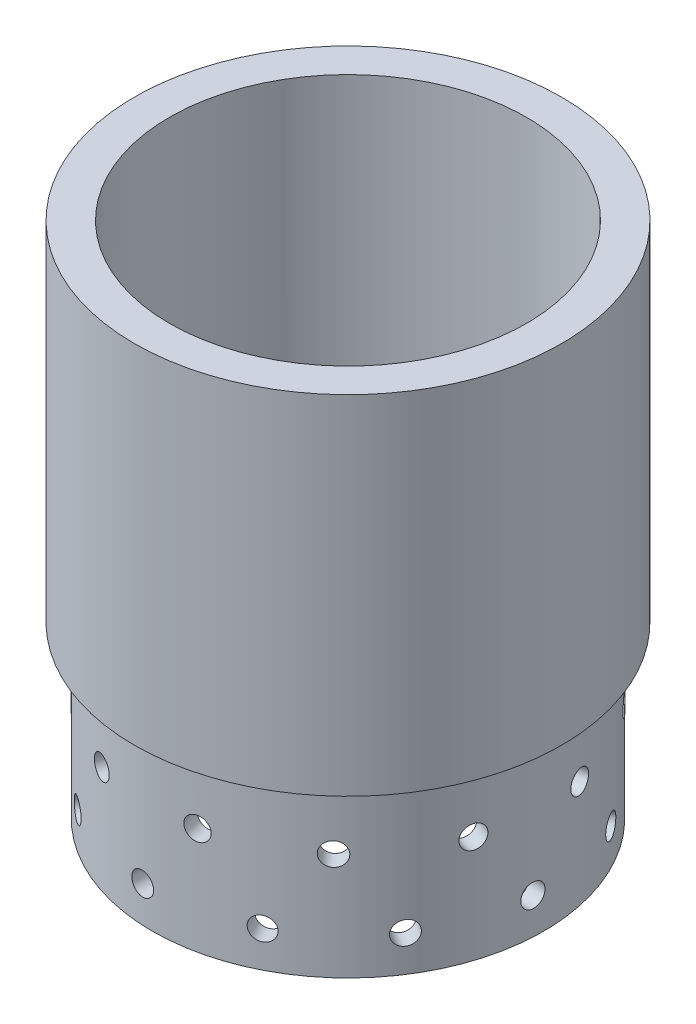
from build123d import *

# Parameters (mm, degrees)
SKETCH1_R           = 69.596
SKETCH1_R_2         = 63.5
BOSS_EXTRUDE1_DEPTH = 57.15
CUT_EXTRUDE2_REACH  = 175.215
SKETCH3_R           = 4.1021
CIRPATTERN2_COUNT   = 12
SKETCH5_R           = 75.946
SKETCH5_R_2         = 63.5
BOSS_EXTRUDE3_DEPTH = 127
MOVE_FACE1_BY       = 3.302
CUT_EXTRUDE3_REACH  = 256.781
SKETCH7_R           = 4.1021
CIRPATTERN3_COUNT   = 12


with BuildPart() as part:
    # Sketch1 → Boss-Extrude1 (new body)
    with BuildSketch(Plane(origin=(0, 0, 0), x_dir=(1, 0, 0), z_dir=(0, 1, 0))):
        Circle(SKETCH1_R)
        Circle(SKETCH1_R_2, mode=Mode.SUBTRACT)
    extrude(amount=BOSS_EXTRUDE1_DEPTH)

    # Sketch3 → Cut-Extrude2 (cut, up to next)
    with BuildSketch(Plane(origin=(-21.506346741, 0, 66.189729308), x_dir=(0, -1, 0), z_dir=(-0.3090169943749482, 0, 0.9510565162951534)), mode=Mode.PRIVATE) as cut_extrude2_sk1:
        with Locations((-38.1, 0)):
            Circle(SKETCH3_R)
    cut_extrude2_tool1 = extrude(cut_extrude2_sk1.sketch, amount=-CUT_EXTRUDE2_REACH, mode=Mode.PRIVATE) & part.part
    cut_extrude2 = cut_extrude2_tool1.solids().sort_by_distance((-21.506347, 38.1, 66.189729))[0]
    add(cut_extrude2, mode=Mode.SUBTRACT)

    # CirPattern2: Cut-Extrude2 ×12 about axis
    cirpattern2_axis = Axis((0, 57.15, 0), (0, -1, 0))
    for i in range(1, CIRPATTERN2_COUNT):
        add(cut_extrude2.rotate(cirpattern2_axis, i * 360 / CIRPATTERN2_COUNT), mode=Mode.SUBTRACT)

    # Sketch5 → Boss-Extrude3 (add)
    with BuildSketch(Plane(origin=(0, 57.15, 0), x_dir=(1, 0, 0), z_dir=(0, 1, 0))):
        Circle(SKETCH5_R)
        Circle(SKETCH5_R_2, mode=Mode.SUBTRACT)
    extrude(amount=BOSS_EXTRUDE3_DEPTH)

    # Move Face1: a face moved inward by 3.302
    extrude(part.faces().sort_by_distance((-37.973, 57.15, 60.7568))[0], amount=MOVE_FACE1_BY, dir=(0, 1, 0), mode=Mode.SUBTRACT)

    # Sketch7 → Cut-Extrude3 (cut, up to next)
    with BuildSketch(Plane(origin=(37.904698281, 0, -58.368116847), x_dir=(0, -1, 0), z_dir=(0.5446390350150282, 0, -0.8386705679454233)), mode=Mode.PRIVATE) as cut_extrude3_sk1:
        with Locations((-12.827, 0)):
            Circle(SKETCH7_R)
    cut_extrude3_tool1 = extrude(cut_extrude3_sk1.sketch, amount=-CUT_EXTRUDE3_REACH, mode=Mode.PRIVATE) & part.part
    cut_extrude3 = cut_extrude3_tool1.solids().sort_by_distance((37.904698, 12.827, -58.368117))[0]
    add(cut_extrude3, mode=Mode.SUBTRACT)

    # CirPattern3: Cut-Extrude3 ×12 about axis
    cirpattern3_axis = Axis((0, 57.15, 0), (0, -1, 0))
    for i in range(1, CIRPATTERN3_COUNT):
        add(cut_extrude3.rotate(cirpattern3_axis, i * 360 / CIRPATTERN3_COUNT), mode=Mode.SUBTRACT)


solid = part.part
